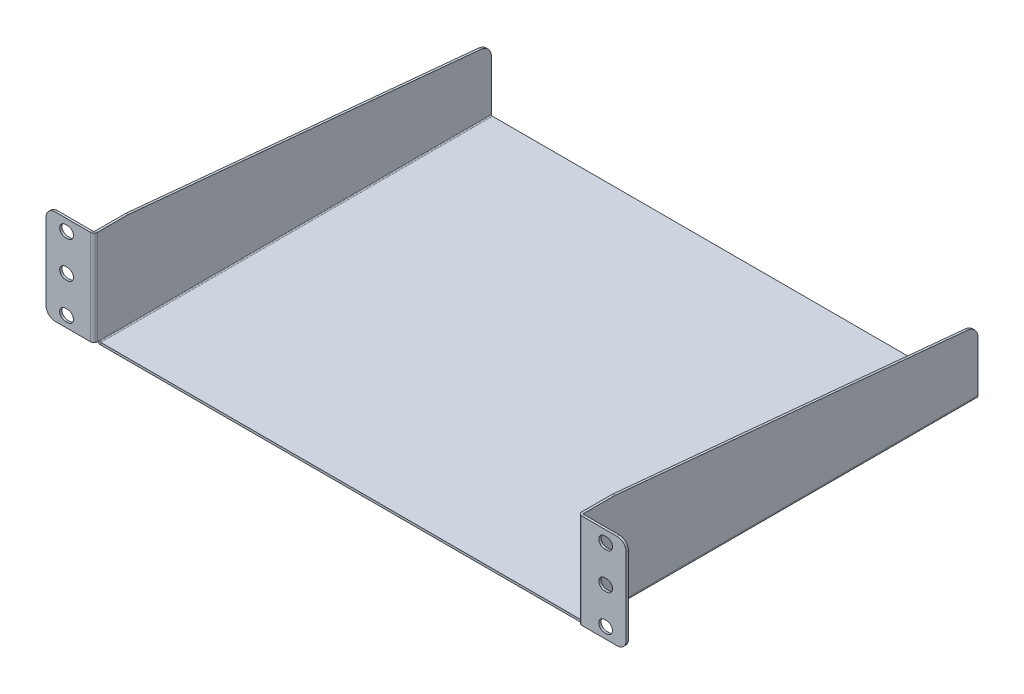
from build123d import *

# Parameters (mm, degrees)
SKETCH1_W                    = 214
SKETCH1_H                    = 174
BASE_FLANGE1_DEPTH           = 1
EDGE_FLANGE3_STRIP_W         = 5
EDGE_FLANGE3_STRIP_H         = 1
EDGE_FLANGE3_STRIP_CUT_DEPTH = 174
EDGE_FLANGE3_DEPTH           = 174
EDGE_FLANGE4_STRIP_W         = 5
EDGE_FLANGE4_STRIP_H         = 1
EDGE_FLANGE4_STRIP_CUT_DEPTH = 174
EDGE_FLANGE4_DEPTH           = 174
EDGE_FLANGE5_STRIP_W         = 5
EDGE_FLANGE5_STRIP_H         = 1
EDGE_FLANGE5_STRIP_CUT_DEPTH = 41.5
EDGE_FLANGE5_DEPTH           = 41.5
EDGE_FLANGE6_STRIP_W         = 5
EDGE_FLANGE6_STRIP_H         = 1
EDGE_FLANGE6_STRIP_CUT_DEPTH = 41.5
EDGE_FLANGE6_DEPTH           = 41.5
FILLET1_R                    = 4
CUT_EXTRUDE1_REACH           = 161.834
SKETCH24_W                   = 214
SKETCH24_H                   = 2.5
SKETCH26_R                   = 2.5
CUT_EXTRUDE2_DEPTH           = 10
CHAMFER1_SIZE                = 1
CUT_EXTRUDE8_DEPTH           = 219.682418132
CUT_EXTRUDE9_DEPTH           = 254.158053397
FILLET2_R                    = 5


# Sheet-metal steps are written as plain solids
with BuildPart() as part:
    # Sketch1 → Base-Flange1 (new body)
    with BuildSketch(Plane(origin=(0, 0, 0), x_dir=(1, 0, 0), z_dir=(0, 1, 0))):
        Rectangle(SKETCH1_W, SKETCH1_H)
    extrude(amount=-BASE_FLANGE1_DEPTH)

    # Edge-Flange3 strip (across the edge) → Edge-Flange3 strip cut (cut)
    with BuildSketch(Plane(origin=(-107, 0, -87), x_dir=(1, 0, 0), z_dir=(0, 0, 1))):
        with Locations((-1, -0.5)):
            Rectangle(EDGE_FLANGE3_STRIP_W, EDGE_FLANGE3_STRIP_H)
    extrude(amount=EDGE_FLANGE3_STRIP_CUT_DEPTH, mode=Mode.SUBTRACT)

    # Edge-Flange3 section (across the edge) → Edge-Flange3 (add)
    with BuildSketch(Plane(origin=(-107, 0, -87), x_dir=(1, 0, 0), z_dir=(0, 0, 1))):
        with BuildLine():
            Line((0, 0.5), (0, 42))
            Line((0, 42), (1, 42))
            Line((1, 42), (1, 0.5))
            ThreePointArc((1, 0.5), (1.146446609, 0.146446609), (1.5, 0))
            Line((1.5, 0), (1.5, -1))
            ThreePointArc((1.5, -1), (0.439339828, -0.560660172), (0, 0.5))
        make_face()
    extrude(amount=EDGE_FLANGE3_DEPTH)

    # Edge-Flange4 strip (across the edge) → Edge-Flange4 strip cut (cut)
    with BuildSketch(Plane(origin=(107, 0, 87), x_dir=(-1, 0, 0), z_dir=(0, 0, -1))):
        with Locations((-1, -0.5)):
            Rectangle(EDGE_FLANGE4_STRIP_W, EDGE_FLANGE4_STRIP_H)
    extrude(amount=EDGE_FLANGE4_STRIP_CUT_DEPTH, mode=Mode.SUBTRACT)

    # Edge-Flange4 section (across the edge) → Edge-Flange4 (add)
    with BuildSketch(Plane(origin=(107, 0, 87), x_dir=(-1, 0, 0), z_dir=(0, 0, -1))):
        with BuildLine():
            Line((0, 0.5), (0, 42))
            Line((0, 42), (1, 42))
            Line((1, 42), (1, 0.5))
            ThreePointArc((1, 0.5), (1.146446609, 0.146446609), (1.5, 0))
            Line((1.5, 0), (1.5, -1))
            ThreePointArc((1.5, -1), (0.439339828, -0.560660172), (0, 0.5))
        make_face()
    extrude(amount=EDGE_FLANGE4_DEPTH)

    # Edge-Flange5 strip (across the edge) → Edge-Flange5 strip cut (cut)
    with BuildSketch(Plane(origin=(107, 42, 87), x_dir=(0, 0, -1), z_dir=(0, -1, 0))):
        with Locations((-1, -0.5)):
            Rectangle(EDGE_FLANGE5_STRIP_W, EDGE_FLANGE5_STRIP_H)
    extrude(amount=EDGE_FLANGE5_STRIP_CUT_DEPTH, mode=Mode.SUBTRACT)

    # Edge-Flange5 section (across the edge) → Edge-Flange5 (add)
    with BuildSketch(Plane(origin=(107, 42, 87), x_dir=(0, 0, -1), z_dir=(0, -1, 0))):
        with BuildLine():
            Line((0, 0.5), (0, 20))
            Line((0, 20), (1, 20))
            Line((1, 20), (1, 0.5))
            ThreePointArc((1, 0.5), (1.146446609, 0.146446609), (1.5, 0))
            Line((1.5, 0), (1.5, -1))
            ThreePointArc((1.5, -1), (0.439339828, -0.560660172), (0, 0.5))
        make_face()
    extrude(amount=EDGE_FLANGE5_DEPTH)

    # Edge-Flange6 strip (across the edge) → Edge-Flange6 strip cut (cut)
    with BuildSketch(Plane(origin=(-107, 0.5, 87), x_dir=(0, 0, -1), z_dir=(0, 1, 0))):
        with Locations((-1, -0.5)):
            Rectangle(EDGE_FLANGE6_STRIP_W, EDGE_FLANGE6_STRIP_H)
    extrude(amount=EDGE_FLANGE6_STRIP_CUT_DEPTH, mode=Mode.SUBTRACT)

    # Edge-Flange6 section (across the edge) → Edge-Flange6 (add)
    with BuildSketch(Plane(origin=(-107, 0.5, 87), x_dir=(0, 0, -1), z_dir=(0, 1, 0))):
        with BuildLine():
            Line((0, 0.5), (0, 20))
            Line((0, 20), (1, 20))
            Line((1, 20), (1, 0.5))
            ThreePointArc((1, 0.5), (1.146446609, 0.146446609), (1.5, 0))
            Line((1.5, 0), (1.5, -1))
            ThreePointArc((1.5, -1), (0.439339828, -0.560660172), (0, 0.5))
        make_face()
    extrude(amount=EDGE_FLANGE6_DEPTH)

    # Fillet1
    fillet1_edges = [part.edges().sort_by_distance(p)[0] for p in [
        (127, 42, 86.5),
        (127, 0.5, 86.5),
        (-127, 0.5, 86.5),
        (-127, 42, 86.5),
    ]]
    fillet(fillet1_edges, radius=FILLET1_R)

    # Cut-Extrude1: up to this face of the body (flat: up to its plane)
    cut_extrude1_end = Plane(part.part.faces().sort_by_distance((114.980552593, 0.5, 86.497536063))[0])
    # Sketch24 → Cut-Extrude1 (cut, up to the picked face)
    with BuildSketch(Plane.XZ.offset(1), mode=Mode.PRIVATE) as cut_extrude1_sk1:
        with Locations((0, 85.75)):
            Rectangle(SKETCH24_W, SKETCH24_H)
    cut_extrude1_tool1 = split(extrude(cut_extrude1_sk1.sketch, amount=-CUT_EXTRUDE1_REACH, mode=Mode.PRIVATE), bisect_by=cut_extrude1_end, keep=Keep.BOTH, mode=Mode.PRIVATE)
    add(cut_extrude1_tool1.solids().sort_by(Axis((0, -1, 85.75), (0, 1, 0)))[0], mode=Mode.SUBTRACT)

    # Sketch26 → Cut-Extrude2 (cut)
    with BuildSketch(Plane.XY.offset(87)):
        with Locations((-118, 37)):
            Circle(SKETCH26_R)
        with Locations((-118, 5.24)):
            Circle(SKETCH26_R)
        with Locations((-118, 21.12)):
            Circle(SKETCH26_R)
        with Locations(Location((118, 5.24, 0), (0, 0, 180))):
            Circle(SKETCH26_R)
        with Locations(Location((118, 21.12, 0), (0, 0, 180))):
            Circle(SKETCH26_R)
        with Locations(Location((118, 37, 0), (0, 0, 180))):
            Circle(SKETCH26_R)
    extrude(amount=-CUT_EXTRUDE2_DEPTH, mode=Mode.SUBTRACT)

    # Chamfer1
    chamfer1_edges = [part.edges().sort_by_distance(p)[0] for p in [
        (-106.5, 42, -87),
        (106.5, 42, -87),
    ]]
    chamfer(chamfer1_edges, length=CHAMFER1_SIZE)

    # Sketch32 → Cut-Extrude8 (cut, through all)
    with BuildSketch(Plane(origin=(0, 0, 86), x_dir=(-1, 0, 0), z_dir=(0, 0, -1))):
        with BuildLine():
            Line((117.5, 39.5), (118.5, 39.5))
            ThreePointArc((118.5, 39.5), (121, 37), (118.5, 34.5))
            Line((118.5, 34.5), (117.5, 34.5))
            ThreePointArc((117.5, 34.5), (115, 37), (117.5, 39.5))
        make_face()
        with BuildLine():
            Line((117.5, 23.62), (118.5, 23.62))
            ThreePointArc((118.5, 23.62), (121, 21.12), (118.5, 18.62))
            Line((118.5, 18.62), (117.5, 18.62))
            ThreePointArc((117.5, 18.62), (115, 21.12), (117.5, 23.62))
        make_face()
        with BuildLine():
            Line((117.5, 7.74), (118.5, 7.74))
            ThreePointArc((118.5, 7.74), (121, 5.24), (118.5, 2.74))
            Line((118.5, 2.74), (117.5, 2.74))
            ThreePointArc((117.5, 2.74), (115, 5.24), (117.5, 7.74))
        make_face()
    cut_extrude8 = extrude(amount=-CUT_EXTRUDE8_DEPTH, mode=Mode.SUBTRACT)

    # Mirror1: Cut-Extrude8 across plane
    add(cut_extrude8.mirror(Plane(origin=(0, 0, 0), x_dir=(0, 0, 1), z_dir=(1, 0, 0))), mode=Mode.SUBTRACT)

    # Sketch41 → Cut-Extrude9 (cut, through all)
    with BuildSketch(Plane.ZY.offset(107)):
        Polygon((-87, 27), (72, 42), (-87, 42), align=None)
    extrude(amount=-CUT_EXTRUDE9_DEPTH, mode=Mode.SUBTRACT)

    # Fillet2
    # the kernel refuses this fillet: 5 mm, written as the material it takes off along each edge
    with BuildSketch(Plane(origin=(105.411683458, 42, 72), x_dir=(0, -0.09392259459562911, -0.9955795027140852), z_dir=(1, 0, 0))) as fillet2_piece_1:
        with BuildLine():
            CenterArc((FILLET2_R * 0.0470653233649, -FILLET2_R), FILLET2_R, 90, 5.38931176)
            Line((-FILLET2_R * 0.0468572712307, -FILLET2_R * 0.00442049728592), (0, 0))
            Line((0, 0), (FILLET2_R * 0.0470653233649, 0))
        make_face()
    extrude(amount=2.176633084, mode=Mode.SUBTRACT)
    with BuildSketch(Plane(origin=(-107.588316542, 42, 72), x_dir=(0, 0, 1), z_dir=(1, 0, 0))) as fillet2_piece_2:
        with BuildLine():
            CenterArc((FILLET2_R * 0.0470653233649, FILLET2_R), FILLET2_R, 264.61068824, 5.38931176)
            Line((-FILLET2_R * 0.0468572712307, FILLET2_R * 0.00442049728592), (0, 0))
            Line((0, 0), (FILLET2_R * 0.0470653233649, 0))
        make_face()
    extrude(amount=2.176633084, mode=Mode.SUBTRACT)
    with BuildSketch(Plane(origin=(94.623743722, 27, -87), x_dir=(0, -1, 0), z_dir=(1, 0, 0))) as fillet2_piece_3:
        with BuildLine():
            CenterArc((FILLET2_R * 0.910100502204, -FILLET2_R), FILLET2_R, 90, 84.61068824)
            Line((-FILLET2_R * 0.0854790005098, -FILLET2_R * 0.906077405404), (0, 0))
            Line((0, 0), (FILLET2_R * 0.910100502204, 0))
        make_face()
    extrude(amount=23.752512555, mode=Mode.SUBTRACT)
    with BuildSketch(Plane(origin=(-118.376256278, 27, -87), x_dir=(0, 0.0939225945956684, 0.9955795027140816), z_dir=(1, 0, 0))) as fillet2_piece_4:
        with BuildLine():
            CenterArc((FILLET2_R * 0.910100502204, FILLET2_R), FILLET2_R, 185.38931176, 84.61068824)
            Line((-FILLET2_R * 0.0854790005098, FILLET2_R * 0.906077405404), (0, 0))
            Line((0, 0), (FILLET2_R * 0.910100502204, 0))
        make_face()
    extrude(amount=23.752512555, mode=Mode.SUBTRACT)


solid = part.part
